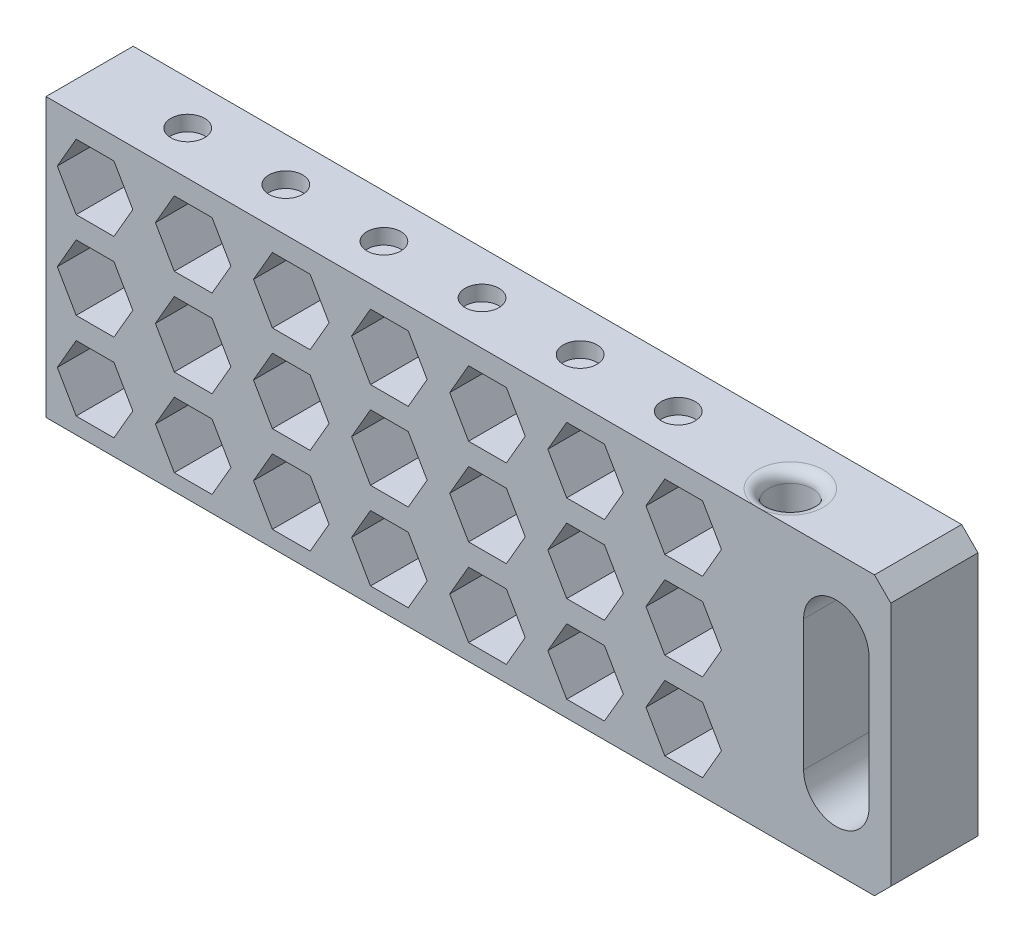
from build123d import *

# Parameters (mm, degrees)
SKETCH1_W           = 330
SKETCH1_H           = 16
BOSS_EXTRUDE1_DEPTH = 51
CUT_EXTRUDE1_REACH  = 336.301
SKETCH2_R           = 3.999999999999999
SKETCH2_R_2         = 3.9999999999999933
CUT_EXTRUDE2_DEPTH  = 16
CUT_EXTRUDE3_REACH  = 336.301
SKETCH5_R           = 3.100000000000002
SKETCH5_R_2         = 3.1000000000000023
SKETCH5_R_3         = 3.099999999999988
CUT_EXTRUDE4_DEPTH  = 2.8
SKETCH6_W           = 175.00000000000014
SKETCH6_H           = 51.00000000000001
CUT_EXTRUDE5_DEPTH  = 335.3007627870448
COVER_DEPTH         = 2.8
CUT_EXTRUDE6_DEPTH  = 2
CHAMFER2_SIZE       = 3
FILLET3_R           = 2
FILLET2_R           = 2
FILLET4_R           = 2


with BuildPart() as part:
    # Sketch1 → Boss-Extrude1 (new body)
    with BuildSketch(Plane(origin=(0, 0, 0), x_dir=(1, 0, 0), z_dir=(0, 1, 0))):
        with Locations((165, 8)):
            Rectangle(SKETCH1_W, SKETCH1_H)
    extrude(amount=BOSS_EXTRUDE1_DEPTH)

    # Sketch2 → Cut-Extrude1 (cut, up to next)
    with BuildSketch(Plane(origin=(0, 51, 0), x_dir=(1, 0, 0), z_dir=(0, 1, 0)), mode=Mode.PRIVATE) as cut_extrude1_sk1:
        with Locations(Location((23, 6, 0), (0, 0, 270))):
            Circle(SKETCH2_R)
    cut_extrude1_tool1 = extrude(cut_extrude1_sk1.sketch, amount=-CUT_EXTRUDE1_REACH, mode=Mode.PRIVATE) & part.part
    # Sketch2 → Cut-Extrude1 (cut, up to next)
    with BuildSketch(Plane(origin=(0, 51, 0), x_dir=(1, 0, 0), z_dir=(0, 1, 0)), mode=Mode.PRIVATE) as cut_extrude1_sk2:
        with Locations(Location((305.575, 6, 0), (0, 0, 270))):
            Circle(SKETCH2_R_2)
    cut_extrude1_tool2 = extrude(cut_extrude1_sk2.sketch, amount=-CUT_EXTRUDE1_REACH, mode=Mode.PRIVATE) & part.part
    add(cut_extrude1_tool1.solids().sort_by_distance((23, 51, -6))[0], mode=Mode.SUBTRACT)
    add(cut_extrude1_tool2.solids().sort_by_distance((305.575, 51, -6))[0], mode=Mode.SUBTRACT)

    # Sketch3 → Cut-Extrude2 (cut)
    with BuildSketch(Plane.XY):
        Polygon((43.46410161513775, 34.99999999999999), (46.92820323027551, 40.99999999999999), (43.46410161513776, 46.999999999999986), (36.53589838486224, 46.999999999999986), (33.07179676972449, 40.999999999999986), (36.53589838486225, 34.99999999999999), align=None)
        Polygon((61.46410161513775, 34.99999999999999), (64.92820323027551, 40.99999999999999), (61.46410161513775, 46.999999999999986), (54.535898384862236, 46.999999999999986), (51.07179676972449, 40.999999999999986), (54.53589838486225, 34.99999999999999), align=None)
        Polygon((79.46410161513775, 34.99999999999999), (82.9282032302755, 40.99999999999999), (79.46410161513775, 46.999999999999986), (72.53589838486224, 46.999999999999986), (69.0717967697245, 40.999999999999986), (72.53589838486224, 34.99999999999999), align=None)
        Polygon((97.46410161513775, 34.99999999999999), (100.9282032302755, 40.99999999999999), (97.46410161513775, 46.999999999999986), (90.53589838486224, 46.999999999999986), (87.07179676972449, 40.999999999999986), (90.53589838486224, 34.99999999999999), align=None)
        Polygon((115.46410161513775, 34.99999999999999), (118.9282032302755, 40.99999999999999), (115.46410161513776, 46.999999999999986), (108.53589838486225, 46.999999999999986), (105.07179676972449, 40.999999999999986), (108.53589838486225, 34.99999999999999), align=None)
        Polygon((133.46410161513774, 34.99999999999999), (136.9282032302755, 40.99999999999999), (133.46410161513774, 46.999999999999986), (126.53589838486224, 46.999999999999986), (123.07179676972449, 40.999999999999986), (126.53589838486224, 34.99999999999999), align=None)
        Polygon((151.46410161513774, 34.99999999999999), (154.9282032302755, 40.99999999999999), (151.46410161513774, 46.999999999999986), (144.5358983848622, 46.999999999999986), (141.07179676972447, 40.999999999999986), (144.53589838486224, 34.99999999999999), align=None)
        Polygon((169.46410161513776, 34.99999999999999), (172.92820323027553, 40.99999999999999), (169.46410161513776, 46.999999999999986), (162.53589838486224, 46.999999999999986), (159.0717967697245, 40.999999999999986), (162.53589838486226, 34.99999999999999), align=None)
        Polygon((187.46410161513774, 34.99999999999999), (190.92820323027547, 40.99999999999999), (187.46410161513774, 46.999999999999986), (180.53589838486224, 46.999999999999986), (177.07179676972447, 40.999999999999986), (180.53589838486224, 34.99999999999999), align=None)
        Polygon((205.46410161513774, 34.99999999999999), (208.9282032302755, 40.99999999999999), (205.46410161513774, 46.999999999999986), (198.5358983848622, 46.999999999999986), (195.07179676972447, 40.999999999999986), (198.53589838486224, 34.99999999999999), align=None)
        Polygon((223.46410161513774, 34.99999999999999), (226.92820323027553, 40.99999999999999), (223.46410161513774, 46.999999999999986), (216.53589838486224, 46.999999999999986), (213.0717967697245, 40.999999999999986), (216.53589838486226, 34.99999999999999), align=None)
        Polygon((241.46410161513774, 34.99999999999999), (244.92820323027547, 40.99999999999999), (241.46410161513774, 46.999999999999986), (234.5358983848622, 46.999999999999986), (231.07179676972447, 40.999999999999986), (234.5358983848622, 34.99999999999999), align=None)
        Polygon((259.46410161513774, 34.99999999999999), (262.92820323027547, 40.99999999999999), (259.46410161513774, 46.999999999999986), (252.53589838486224, 46.999999999999986), (249.07179676972447, 40.999999999999986), (252.53589838486224, 34.99999999999999), align=None)
        Polygon((277.46410161513774, 34.99999999999999), (280.9282032302755, 40.99999999999999), (277.46410161513774, 46.999999999999986), (270.53589838486226, 46.999999999999986), (267.0717967697245, 40.999999999999986), (270.53589838486226, 34.99999999999999), align=None)
        Polygon((295.46410161513774, 34.99999999999999), (298.9282032302755, 40.99999999999999), (295.46410161513774, 46.999999999999986), (288.53589838486226, 46.999999999999986), (285.0717967697245, 40.999999999999986), (288.53589838486226, 34.99999999999999), align=None)
        Polygon((61.46410161513792, 18.99999999999999), (64.92820323027567, 24.999999999999993), (61.46410161513792, 30.999999999999986), (54.535898384862406, 30.999999999999986), (51.07179676972466, 24.999999999999986), (54.53589838486242, 18.99999999999999), align=None)
        Polygon((79.46410161513792, 18.99999999999999), (82.92820323027567, 24.999999999999993), (79.46410161513792, 30.999999999999986), (72.5358983848624, 30.999999999999986), (69.07179676972467, 24.999999999999986), (72.5358983848624, 18.99999999999999), align=None)
        Polygon((97.4641016151379, 18.99999999999999), (100.92820323027567, 24.999999999999993), (97.4641016151379, 30.999999999999986), (90.53589838486239, 30.999999999999986), (87.07179676972466, 24.999999999999986), (90.5358983848624, 18.99999999999999), align=None)
        Polygon((115.4641016151379, 18.99999999999999), (118.92820323027567, 24.999999999999993), (115.46410161513792, 30.999999999999986), (108.5358983848624, 30.999999999999986), (105.07179676972466, 24.999999999999986), (108.5358983848624, 18.99999999999999), align=None)
        Polygon((133.4641016151379, 18.99999999999999), (136.92820323027567, 24.999999999999993), (133.4641016151379, 30.999999999999986), (126.5358983848624, 30.999999999999986), (123.07179676972466, 24.999999999999986), (126.5358983848624, 18.99999999999999), align=None)
        Polygon((151.4641016151379, 18.99999999999999), (154.92820323027567, 24.999999999999993), (151.4641016151379, 30.999999999999986), (144.53589838486238, 30.999999999999986), (141.07179676972464, 24.999999999999986), (144.5358983848624, 18.99999999999999), align=None)
        Polygon((169.4641016151379, 18.99999999999999), (172.9282032302757, 24.999999999999993), (169.4641016151379, 30.999999999999986), (162.5358983848624, 30.999999999999986), (159.07179676972467, 24.999999999999986), (162.53589838486243, 18.99999999999999), align=None)
        Polygon((187.4641016151379, 18.99999999999999), (190.92820323027564, 24.999999999999993), (187.4641016151379, 30.999999999999986), (180.53589838486238, 30.999999999999986), (177.07179676972464, 24.999999999999986), (180.53589838486238, 18.99999999999999), align=None)
        Polygon((205.4641016151379, 18.99999999999999), (208.92820323027567, 24.999999999999993), (205.4641016151379, 30.999999999999986), (198.53589838486238, 30.999999999999986), (195.07179676972464, 24.999999999999986), (198.5358983848624, 18.99999999999999), align=None)
        Polygon((223.4641016151379, 18.99999999999999), (226.92820323027567, 24.999999999999993), (223.4641016151379, 30.999999999999986), (216.5358983848624, 30.999999999999986), (213.07179676972464, 24.999999999999986), (216.53589838486243, 18.99999999999999), align=None)
        Polygon((241.4641016151379, 18.99999999999999), (244.92820323027564, 24.999999999999993), (241.4641016151379, 30.999999999999986), (234.53589838486238, 30.999999999999986), (231.07179676972464, 24.999999999999986), (234.53589838486238, 18.99999999999999), align=None)
        Polygon((259.4641016151379, 18.99999999999999), (262.92820323027564, 24.999999999999993), (259.4641016151379, 30.999999999999986), (252.5358983848624, 30.999999999999986), (249.07179676972464, 24.999999999999986), (252.5358983848624, 18.99999999999999), align=None)
        Polygon((277.4641016151379, 18.99999999999999), (280.9282032302757, 24.999999999999993), (277.4641016151379, 30.999999999999986), (270.53589838486243, 30.999999999999986), (267.07179676972464, 24.999999999999986), (270.53589838486243, 18.99999999999999), align=None)
        Polygon((295.4641016151379, 18.99999999999999), (298.9282032302757, 24.999999999999993), (295.4641016151379, 30.999999999999986), (288.53589838486243, 30.999999999999986), (285.07179676972464, 24.999999999999986), (288.53589838486243, 18.99999999999999), align=None)
        Polygon((61.464101615138084, 2.999999999999989), (64.92820323027584, 8.999999999999995), (61.464101615138084, 14.999999999999986), (54.53589838486257, 14.999999999999986), (51.07179676972483, 8.999999999999988), (54.535898384862584, 2.999999999999989), align=None)
        Polygon((79.46410161513809, 2.999999999999989), (82.92820323027583, 8.999999999999995), (79.46410161513809, 14.999999999999986), (72.53589838486258, 14.999999999999986), (69.07179676972483, 8.999999999999988), (72.53589838486258, 2.999999999999989), align=None)
        Polygon((97.46410161513808, 2.999999999999989), (100.92820323027584, 8.999999999999995), (97.46410161513808, 14.999999999999986), (90.53589838486256, 14.999999999999986), (87.07179676972481, 8.999999999999988), (90.53589838486258, 2.999999999999989), align=None)
        Polygon((115.46410161513808, 2.999999999999989), (118.92820323027584, 8.999999999999995), (115.46410161513809, 14.999999999999986), (108.53589838486258, 14.999999999999986), (105.07179676972483, 8.999999999999988), (108.53589838486258, 2.999999999999989), align=None)
        Polygon((133.46410161513808, 2.999999999999989), (136.9282032302758, 8.999999999999995), (133.46410161513808, 14.999999999999986), (126.53589838486256, 14.999999999999986), (123.07179676972483, 8.999999999999988), (126.53589838486256, 2.999999999999989), align=None)
        Polygon((151.46410161513808, 2.999999999999989), (154.92820323027584, 8.999999999999995), (151.46410161513808, 14.999999999999986), (144.53589838486255, 14.999999999999986), (141.0717967697248, 8.999999999999988), (144.53589838486258, 2.999999999999989), align=None)
        Polygon((169.46410161513808, 2.999999999999989), (172.92820323027587, 8.999999999999995), (169.46410161513808, 14.999999999999986), (162.53589838486258, 14.999999999999986), (159.0717967697248, 8.999999999999988), (162.5358983848626, 2.999999999999989), align=None)
        Polygon((187.46410161513808, 2.999999999999989), (190.9282032302758, 8.999999999999995), (187.46410161513808, 14.999999999999986), (180.53589838486255, 14.999999999999986), (177.0717967697248, 8.999999999999988), (180.53589838486255, 2.999999999999989), align=None)
        Polygon((205.46410161513805, 2.999999999999989), (208.92820323027584, 8.999999999999995), (205.46410161513805, 14.999999999999986), (198.53589838486255, 14.999999999999986), (195.0717967697248, 8.999999999999988), (198.53589838486258, 2.999999999999989), align=None)
        Polygon((223.46410161513808, 2.999999999999989), (226.92820323027584, 8.999999999999995), (223.46410161513808, 14.999999999999986), (216.53589838486258, 14.999999999999986), (213.0717967697248, 8.999999999999988), (216.53589838486258, 2.999999999999989), align=None)
        Polygon((241.46410161513808, 2.999999999999989), (244.9282032302758, 8.999999999999995), (241.46410161513808, 14.999999999999986), (234.53589838486255, 14.999999999999986), (231.0717967697248, 8.999999999999988), (234.53589838486255, 2.999999999999989), align=None)
        Polygon((259.4641016151381, 2.999999999999989), (262.9282032302758, 8.999999999999995), (259.4641016151381, 14.999999999999986), (252.53589838486258, 14.999999999999986), (249.07179676972478, 8.999999999999988), (252.53589838486258, 2.999999999999989), align=None)
        Polygon((277.4641016151381, 2.999999999999989), (280.92820323027587, 8.999999999999995), (277.4641016151381, 14.999999999999986), (270.5358983848626, 14.999999999999986), (267.0717967697248, 8.999999999999988), (270.5358983848626, 2.999999999999989), align=None)
        Polygon((295.4641016151381, 2.999999999999989), (298.92820323027587, 8.999999999999995), (295.4641016151381, 14.999999999999986), (288.5358983848626, 14.999999999999986), (285.0717967697248, 8.999999999999988), (288.5358983848626, 2.999999999999989), align=None)
        Polygon((43.46410161513792, 18.99999999999999), (46.92820323027568, 24.999999999999993), (43.46410161513793, 30.999999999999986), (36.53589838486241, 30.999999999999986), (33.071796769724656, 24.999999999999986), (36.53589838486241, 18.99999999999999), align=None)
        Polygon((43.464101615138084, 2.999999999999989), (46.92820323027584, 8.999999999999995), (43.46410161513809, 14.999999999999986), (36.53589838486258, 14.999999999999986), (33.07179676972483, 8.999999999999988), (36.535898384862584, 2.999999999999989), align=None)
    extrude(amount=-CUT_EXTRUDE2_DEPTH, mode=Mode.SUBTRACT)

    # Sketch4 → Cut-Extrude3 (cut, up to next)
    with BuildSketch(Plane.XY, mode=Mode.PRIVATE) as cut_extrude3_sk1:
        with BuildLine():
            Line((4.000000000000005, 13.499999999999998), (4.000000000000005, 37.5))
            ThreePointArc((4.000000000000005, 37.5), (10.000000000000005, 43.5), (16.000000000000007, 37.5))
            Line((16.000000000000007, 37.5), (16.000000000000007, 13.499999999999998))
            ThreePointArc((16.000000000000007, 13.499999999999998), (10.000000000000004, 7.499999999999998), (4.000000000000005, 13.499999999999998))
        make_face()
    cut_extrude3_tool1 = extrude(cut_extrude3_sk1.sketch, amount=-CUT_EXTRUDE3_REACH, mode=Mode.PRIVATE) & part.part
    # Sketch4 → Cut-Extrude3 (cut, up to next)
    with BuildSketch(Plane.XY, mode=Mode.PRIVATE) as cut_extrude3_sk2:
        with BuildLine():
            Line((326, 13.499999999999998), (326, 37.5))
            ThreePointArc((326, 37.5), (320, 43.5), (314, 37.5))
            Line((314, 37.5), (314, 13.499999999999998))
            ThreePointArc((314, 13.499999999999998), (320, 7.499999999999998), (326, 13.499999999999998))
        make_face()
    cut_extrude3_tool2 = extrude(cut_extrude3_sk2.sketch, amount=-CUT_EXTRUDE3_REACH, mode=Mode.PRIVATE) & part.part
    add(cut_extrude3_tool1.solids().sort_by_distance((10, 25.5, 0))[0], mode=Mode.SUBTRACT)
    add(cut_extrude3_tool2.solids().sort_by_distance((320, 25.5, 0))[0], mode=Mode.SUBTRACT)

    # Sketch5 → Cut-Extrude4 (cut)
    with BuildSketch(Plane(origin=(0, 51, 0), x_dir=(1, 0, 0), z_dir=(0, 1, 0))):
        with Locations(Location((49, 8, 0), (0, 0, 270))):
            Circle(SKETCH5_R)
        with Locations(Location((67, 8, 0), (0, 0, 270))):
            Circle(SKETCH5_R_2)
        with Locations(Location((84.99999999999999, 8, 0), (0, 0, 270))):
            Circle(SKETCH5_R_2)
        with Locations(Location((103, 8, 0), (0, 0, 270))):
            Circle(SKETCH5_R_2)
        with Locations(Location((121, 8, 0), (0, 0, 270))):
            Circle(SKETCH5_R_2)
        with Locations(Location((139, 8, 0), (0, 0, 270))):
            Circle(SKETCH5_R_3)
        with Locations(Location((156.99999999999997, 8, 0), (0, 0, 270))):
            Circle(SKETCH5_R_3)
        with Locations(Location((175, 8, 0), (0, 0, 270))):
            Circle(SKETCH5_R_3)
        with Locations(Location((193, 8, 0), (0, 0, 270))):
            Circle(SKETCH5_R_3)
        with Locations(Location((210.99999999999997, 8, 0), (0, 0, 270))):
            Circle(SKETCH5_R_3)
        with Locations(Location((228.99999999999997, 8, 0), (0, 0, 270))):
            Circle(SKETCH5_R_3)
        with Locations(Location((247, 8, 0), (0, 0, 270))):
            Circle(SKETCH5_R_3)
        with Locations(Location((264.99999999999994, 8, 0), (0, 0, 270))):
            Circle(SKETCH5_R_3)
        with Locations(Location((283, 8, 0), (0, 0, 270))):
            Circle(SKETCH5_R_3)
    cut_extrude4 = extrude(amount=-CUT_EXTRUDE4_DEPTH, mode=Mode.SUBTRACT)

    # Sketch6 → Cut-Extrude5 (cut, through all)
    with BuildSketch(Plane.XY):
        with Locations((87.50000000000007, 25.500000000000004)):
            Rectangle(SKETCH6_W, SKETCH6_H)
    extrude(amount=-CUT_EXTRUDE5_DEPTH, mode=Mode.SUBTRACT)

    # Sketch7 → Cover (add)
    with BuildSketch(Plane(origin=(0, 51, 0), x_dir=(1, 0, 0), z_dir=(0, 1, 0))):
        with BuildLine():
            Line((175, 11.099999999999989), (175, 4.900000000000012))
            ThreePointArc((175, 4.900000000000012), (178.1, 8), (175, 11.099999999999989))
        make_face()
    cover = extrude(amount=-COVER_DEPTH)

    # Sketch8 → Cut-Extrude6 (cut)
    with BuildSketch(Plane.ZY.offset(-175.00000000000014)):
        Polygon((-12.05, 3.9), (-3.95, 3.9000000000000012), (-3.950000000000016, 47.099999999999994), (-12.05, 47.099999999999994), align=None)
    extrude(amount=-CUT_EXTRUDE6_DEPTH, mode=Mode.SUBTRACT)

    # Chamfer2
    chamfer2_edges = [part.edges().sort_by_distance(p)[0] for p in [
        (330, 51, -8),
        (330, 0, -8),
    ]]
    chamfer(chamfer2_edges, length=CHAMFER2_SIZE)

    # Fillet3
    fillet3_edges = [part.edges().sort_by_distance(p)[0] for p in [
        (305.575, 51, -9.999999999999993),
    ]]
    fillet(fillet3_edges, radius=FILLET3_R)

    # Mirror1: Cut-Extrude4, Cover across plane
    add(cut_extrude4.mirror(Plane(origin=(0, 25.5, 0), x_dir=(0, 0, 1), z_dir=(0, -1, 0))), mode=Mode.SUBTRACT)
    add(cover.mirror(Plane(origin=(0, 25.5, 0), x_dir=(0, 0, 1), z_dir=(0, -1, 0))))

    # Fillet2
    fillet2_edges = [part.edges().sort_by_distance(p)[0] for p in [
        (175.00000000000014, 3.9000000000000004, -8),
        (175.00000000000014, 25.5, -3.950000000000008),
        (175.00000000000014, 47.099999999999994, -8.000000000000007),
        (175.00000000000014, 25.499999999999996, -12.05),
    ]]
    fillet(fillet2_edges, radius=FILLET2_R - 0.0001)  # a hair under: the kernel refuses the full size

    # Fillet4
    fillet4_edges = [part.edges().sort_by_distance(p)[0] for p in [
        (305.575, 0, -9.999999999999993),
    ]]
    fillet(fillet4_edges, radius=FILLET4_R)


solid = part.part
